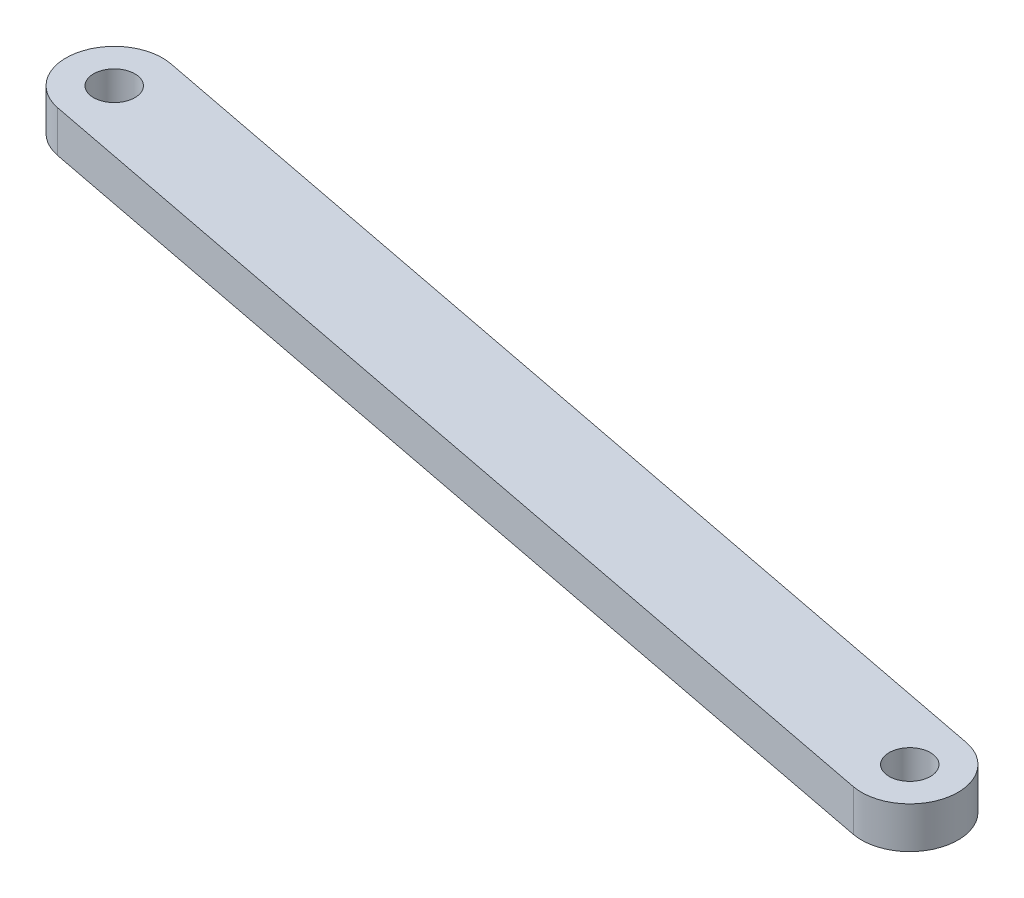
from build123d import *

# Parameters (mm, degrees)
SKETCH2_R           = 1.5
BOSS_EXTRUDE2_DEPTH = 3


with BuildPart() as part:
    # Sketch2 → Boss-Extrude2 (new body)
    with BuildSketch(Plane(origin=(0, 84, 0), x_dir=(1, 0, 0), z_dir=(0, 1, 0))):
        with BuildLine():
            Line((-4.33725104, 90.936678789), (-75.841894829, 104.726058307))
            ThreePointArc((-75.841894829, 104.726058307), (-79.941323466, 101.952128811), (-77.167393969, 97.852700174))
            Line((-77.167393969, 97.852700174), (-5.66275018, 84.063320655))
            ThreePointArc((-5.66275018, 84.063320655), (-1.563321543, 86.837250152), (-4.33725104, 90.936678789))
        make_face()
        with Locations((-5.00000061, 87.499999722)):
            Circle(SKETCH2_R, mode=Mode.SUBTRACT)
        with Locations((-76.504644399, 101.28937924)):
            Circle(SKETCH2_R, mode=Mode.SUBTRACT)
    extrude(amount=BOSS_EXTRUDE2_DEPTH)


solid = part.part
